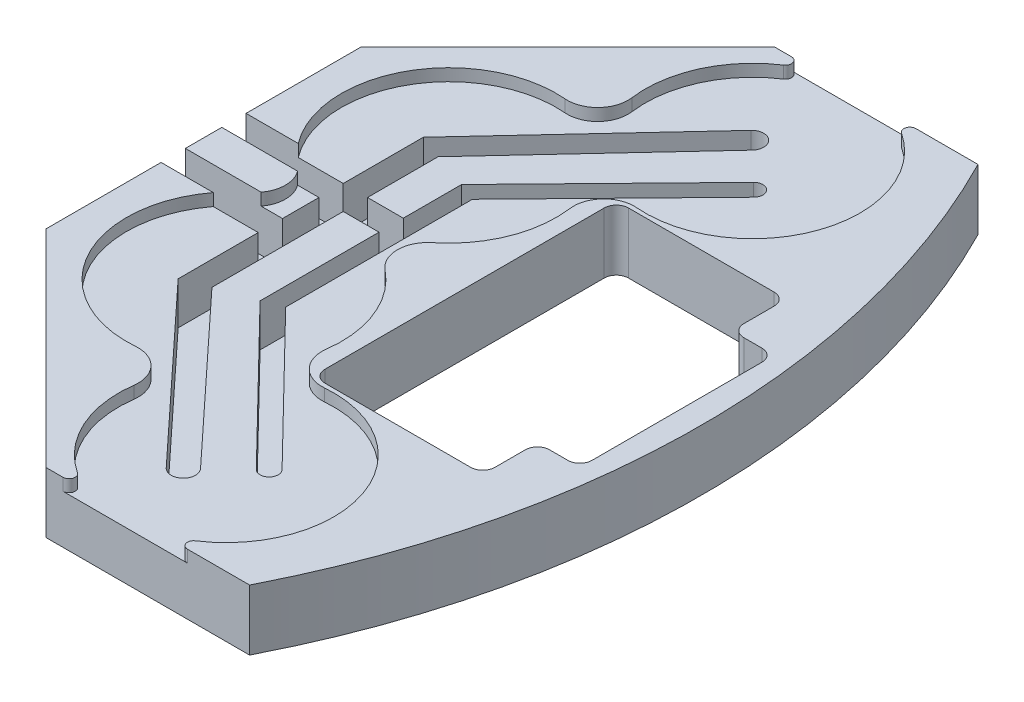
from build123d import *

# Parameters (mm, degrees)
BOSS_EXTRUDE1_DEPTH = 10
CUT_EXTRUDE4_DEPTH  = 2
FILLET3_R           = 5
FILLET5_R           = 1
CUT_EXTRUDE5_REACH  = 147.341
SKETCH3_W           = 28
SKETCH3_H           = 50
CUT_EXTRUDE8_REACH  = 147.341
SKETCH6_W           = 7
SKETCH6_H           = 32
FILLET4_R           = 2
CUT_EXTRUDE6_DEPTH  = 9
SKETCH5_W           = 25.903463104
SKETCH5_H           = 4
SKETCH5_W_2         = 16.006536896
CUT_EXTRUDE7_DEPTH  = 9


with BuildPart() as part:
    # Sketch1 → Boss-Extrude1 (new body)
    with BuildSketch(Plane(origin=(0, 0, 0), x_dir=(1, 0, 0), z_dir=(0, 1, 0))):
        with BuildLine():
            Line((50, 25.95836944), (84.04163056, 60))
            Line((84.04163056, 60), (117.575507654, 60))
            ThreePointArc((117.575507654, 60), (128.343225396, 30.854764541), (132, 0))
            Line((132, 0), (50, 0))
            Line((50, 0), (50, 25.95836944))
        make_face()
    boss_extrude1 = extrude(amount=BOSS_EXTRUDE1_DEPTH)

    # Sketch2 → Cut-Extrude4 (cut)
    with BuildSketch(Plane(origin=(0, 10, 0), x_dir=(1, 0, 0), z_dir=(0, 1, 0))):
        with BuildLine():
            ThreePointArc((85.205505809, 30.238117065), (109.295165413, 56.187671014), (84.595641082, 30.817914456))
            ThreePointArc((84.595641082, 30.817914456), (56.263418534, 24.268213142), (72.28425661, 0))
            Line((72.28425661, 0), (73.12574339, 0))
            ThreePointArc((73.12574339, 0), (89.146581466, 11.131786858), (85.205505809, 30.238117065))
        make_face()
    cut_extrude4 = extrude(amount=-CUT_EXTRUDE4_DEPTH, mode=Mode.SUBTRACT)

    # Mirror2: Boss-Extrude1, Cut-Extrude4 across plane
    add(boss_extrude1.mirror(Plane.XY))
    add(cut_extrude4.mirror(Plane.XY), mode=Mode.SUBTRACT)

    # Fillet3
    fillet3_edges = [part.edges().sort_by_distance(p)[0] for p in [
        (84.595641082, 9, 30.817914456),
        (85.205505809, 9, 30.238117065),
        (72.28425661, 9, 0),
        (73.12574339, 9, 0),
        (84.595641082, 9, -30.817914456),
        (85.205505809, 9, -30.238117065),
    ]]
    fillet(fillet3_edges, radius=FILLET3_R)

    # Fillet5
    fillet5_edges = [part.edges().sort_by_distance(p)[0] for p in [
        (91.059149438, 9, 60),
        (103.133144343, 9, 60),
        (91.059149438, 9, -60),
        (103.133144343, 9, -60),
    ]]
    fillet(fillet5_edges, radius=FILLET5_R)

    # Sketch3 → Cut-Extrude5 (cut, up to next)
    with BuildSketch(Plane(origin=(0, 10, 0), x_dir=(1, 0, 0), z_dir=(0, 1, 0)), mode=Mode.PRIVATE) as cut_extrude5_sk1:
        with Locations((107, 0)):
            Rectangle(SKETCH3_W, SKETCH3_H)
    cut_extrude5_tool1 = extrude(cut_extrude5_sk1.sketch, amount=-CUT_EXTRUDE5_REACH, mode=Mode.PRIVATE) & part.part
    add(cut_extrude5_tool1.solids().sort_by_distance((107, 10, 0))[0], mode=Mode.SUBTRACT)

    # Sketch6 → Cut-Extrude8 (cut, up to next)
    with BuildSketch(Plane(origin=(0, 10, 0), x_dir=(1, 0, 0), z_dir=(0, 1, 0)), mode=Mode.PRIVATE) as cut_extrude8_sk1:
        with Locations((124.5, 0)):
            Rectangle(SKETCH6_W, SKETCH6_H)
    cut_extrude8_tool1 = extrude(cut_extrude8_sk1.sketch, amount=-CUT_EXTRUDE8_REACH, mode=Mode.PRIVATE) & part.part
    add(cut_extrude8_tool1.solids().sort_by_distance((124.5, 10, 0))[0], mode=Mode.SUBTRACT)

    # Fillet4
    fillet4_edges = [part.edges().sort_by_distance(p)[0] for p in [
        (121, 5, 25),
        (93, 5, 25),
        (121, 5, -25),
        (93, 5, -25),
        (121, 5, 16),
        (128, 5, 16),
        (121, 5, -16),
        (128, 5, -16),
    ]]
    fillet(fillet4_edges, radius=FILLET4_R)

    # Sketch4 → Cut-Extrude6 (cut)
    with BuildSketch(Plane(origin=(0, 10, 0), x_dir=(1, 0, 0), z_dir=(0, 1, 0))):
        with BuildLine():
            Line((92.007663365, 48.162911495), (66.006536896, 20.196190696))
            Line((66.006536896, 20.196190696), (66.006536896, -20.196190696))
            Line((66.006536896, -20.196190696), (92.007663365, -48.162911495))
            ThreePointArc((92.007663365, -48.162911495), (94.834216355, -48.265859024), (94.937163885, -45.439306034))
            Line((94.937163885, -45.439306034), (70.006536896, -18.624010737))
            Line((70.006536896, -18.624010737), (70.006536896, 18.624010737))
            Line((70.006536896, 18.624010737), (94.937163885, 45.439306034))
            ThreePointArc((94.937163885, 45.439306034), (94.834216355, 48.265859024), (92.007663365, 48.162911495))
        make_face()
        with BuildLine():
            Line((101.79402875, -38.863956282), (78.903463104, -15.379795813))
            Line((78.903463104, -15.379795813), (78.903463104, 15.379795813))
            Line((78.903463104, 15.379795813), (101.79402875, 38.863956282))
            ThreePointArc((101.79402875, 38.863956282), (101.76687815, 40.985102869), (99.645731562, 40.95795227))
            Line((99.645731562, 40.95795227), (75.903463104, 16.600002754))
            Line((75.903463104, 16.600002754), (75.903463104, -16.600002754))
            Line((75.903463104, -16.600002754), (99.645731562, -40.95795227))
            ThreePointArc((99.645731562, -40.95795227), (101.76687815, -40.985102869), (101.79402875, -38.863956282))
        make_face()
    extrude(amount=-CUT_EXTRUDE6_DEPTH, mode=Mode.SUBTRACT)

    # Sketch5 → Cut-Extrude7 (cut)
    with BuildSketch(Plane(origin=(0, 10, 0), x_dir=(1, 0, 0), z_dir=(0, 1, 0))):
        with Locations((62.951731552, 5)):
            Rectangle(SKETCH5_W, SKETCH5_H)
        with Locations((58.003268448, -5)):
            Rectangle(SKETCH5_W_2, SKETCH5_H)
    extrude(amount=-CUT_EXTRUDE7_DEPTH, mode=Mode.SUBTRACT)


solid = part.part
